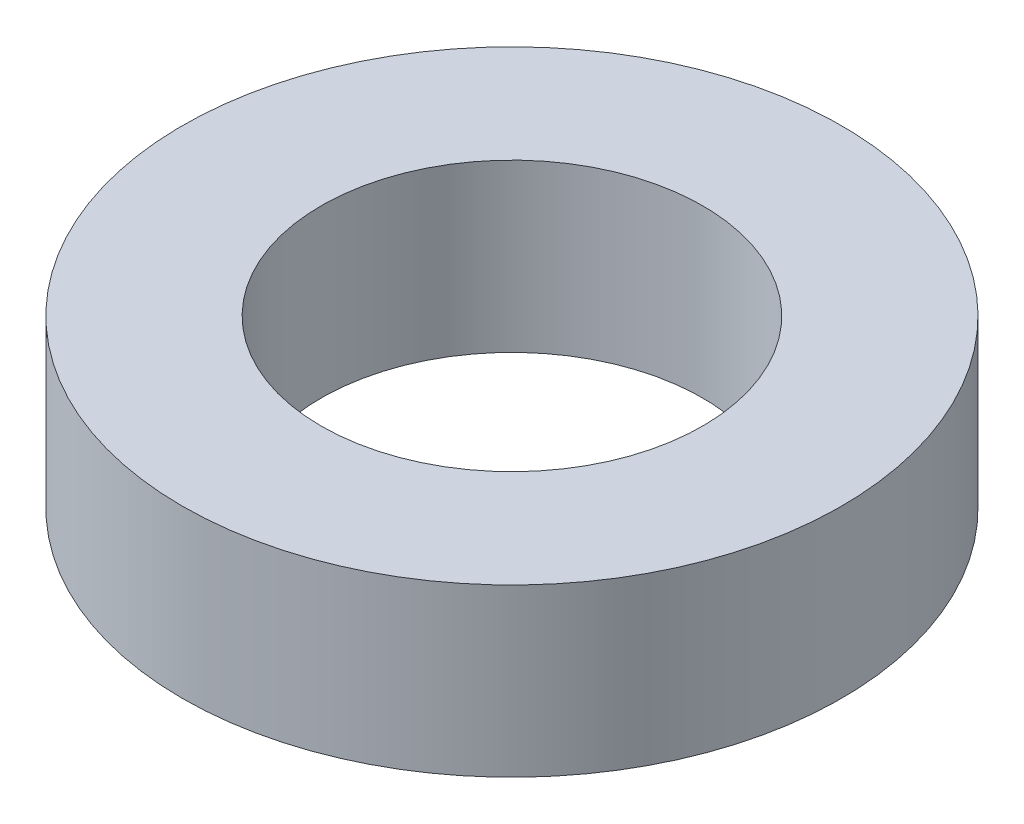
from build123d import *

# Parameters (mm, degrees)
SKETCH1_R           = 47.5
BOSS_EXTRUDE1_DEPTH = 24
SKETCH2_R           = 27.5
CUT_EXTRUDE1_DEPTH  = 72.33372274


with BuildPart() as part:
    # Sketch1 → Boss-Extrude1 (new body)
    with BuildSketch(Plane(origin=(0, 0, 0), x_dir=(1, 0, 0), z_dir=(0, 1, 0))):
        Circle(SKETCH1_R)
    extrude(amount=BOSS_EXTRUDE1_DEPTH)

    # Sketch2 → Cut-Extrude1 (cut, through all)
    with BuildSketch(Plane(origin=(0, 0, 0), x_dir=(1, 0, 0), z_dir=(0, 1, 0))):
        Circle(SKETCH2_R)
    extrude(amount=CUT_EXTRUDE1_DEPTH, mode=Mode.SUBTRACT)


solid = part.part
